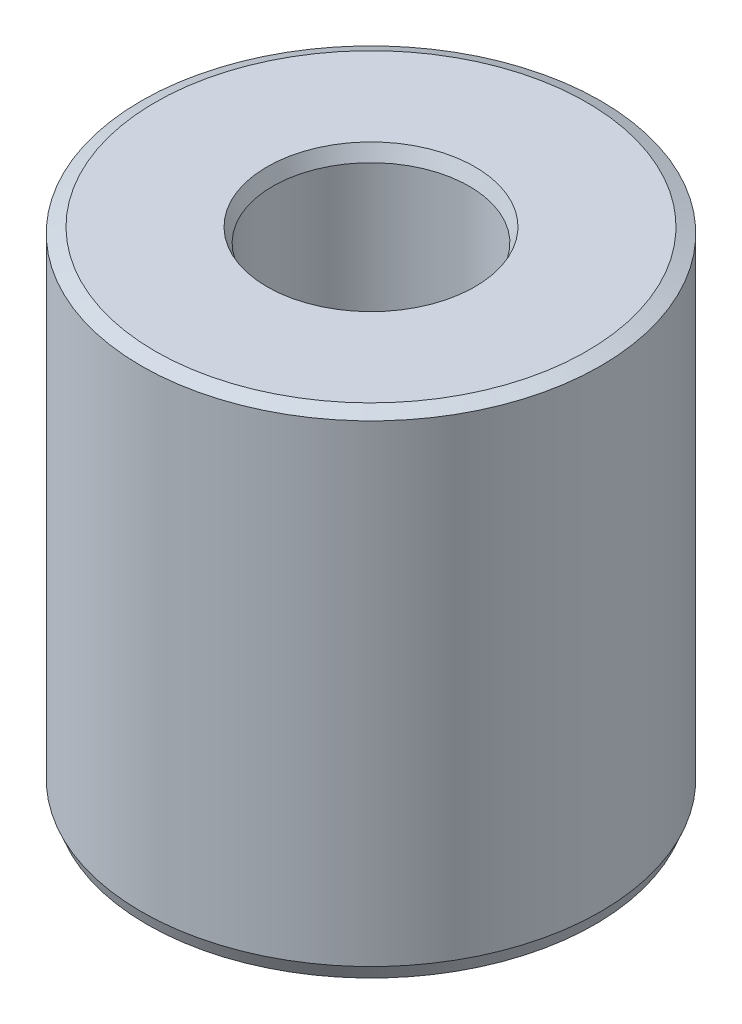
from build123d import *
from OCP.BRepFilletAPI import BRepFilletAPI_MakeChamfer

# Parameters (mm, degrees)
SKETCH1_R           = 17.5
BOSS_EXTRUDE1_DEPTH = 37.51164677
SKETCH2_R           = 7.486502431
CUT_EXTRUDE1_DEPTH  = 45.940223002
CHAMFER1_SIZE       = 0.435408369
CHAMFER1_SIZE2      = 1.064412988


with BuildPart() as part:
    # Sketch1 → Boss-Extrude1 (new body)
    with BuildSketch(Plane(origin=(0, 0, 0), x_dir=(1, 0, 0), z_dir=(0, 1, 0))):
        Circle(SKETCH1_R)
    extrude(amount=BOSS_EXTRUDE1_DEPTH)

    # Sketch2 → Cut-Extrude1 (cut, through all)
    with BuildSketch(Plane(origin=(0, 0, 0), x_dir=(1, 0, 0), z_dir=(0, 1, 0))):
        Circle(SKETCH2_R)
    extrude(amount=CUT_EXTRUDE1_DEPTH, mode=Mode.SUBTRACT)

    # Chamfer1: one chamfer whose edges measure the first distance from different faces: ONE call of the kernel's chamfer builder (chamfer() names one face for all edges)
    chamfer1_edges_1 = [part.edges().sort_by_distance(p)[0] for p in [
        (-7.486502431, 37.51164677, 0),
    ]]
    chamfer1_side_1 = [part.faces().sort_by_distance(p)[0] for p in [
        (-17.005025253, 37.51164677, 0),
    ]]
    chamfer1_edges_2 = [part.edges().sort_by_distance(p)[0] for p in [
        (-7.486502431, 0, 0),
    ]]
    chamfer1_side_2 = [part.faces().sort_by_distance(p)[0] for p in [
        (-7.486502431, 18.755823385, 0),
    ]]
    chamfer1_edges_3 = [part.edges().sort_by_distance(p)[0] for p in [
        (-17.5, 0, 0),
    ]]
    chamfer1_side_3 = [part.faces().sort_by_distance(p)[0] for p in [
        (-17.005025253, 0, 0),
    ]]
    chamfer1_edges_4 = [part.edges().sort_by_distance(p)[0] for p in [
        (-17.5, 37.51164677, 0),
    ]]
    chamfer1_side_4 = [part.faces().sort_by_distance(p)[0] for p in [
        (-17.5, 18.755823385, 0),
    ]]
    chamfer1 = BRepFilletAPI_MakeChamfer(part.part.solid().wrapped)
    for e in chamfer1_edges_1:
        chamfer1.Add(CHAMFER1_SIZE, CHAMFER1_SIZE2, e.wrapped, chamfer1_side_1[0].wrapped)  # the first distance lies on this face
    for e in chamfer1_edges_2:
        chamfer1.Add(CHAMFER1_SIZE, CHAMFER1_SIZE2, e.wrapped, chamfer1_side_2[0].wrapped)  # the first distance lies on this face
    for e in chamfer1_edges_3:
        chamfer1.Add(CHAMFER1_SIZE, CHAMFER1_SIZE2, e.wrapped, chamfer1_side_3[0].wrapped)  # the first distance lies on this face
    for e in chamfer1_edges_4:
        chamfer1.Add(CHAMFER1_SIZE, CHAMFER1_SIZE2, e.wrapped, chamfer1_side_4[0].wrapped)  # the first distance lies on this face
    add(Compound.cast(chamfer1.Shape()), mode=Mode.REPLACE)


solid = part.part
